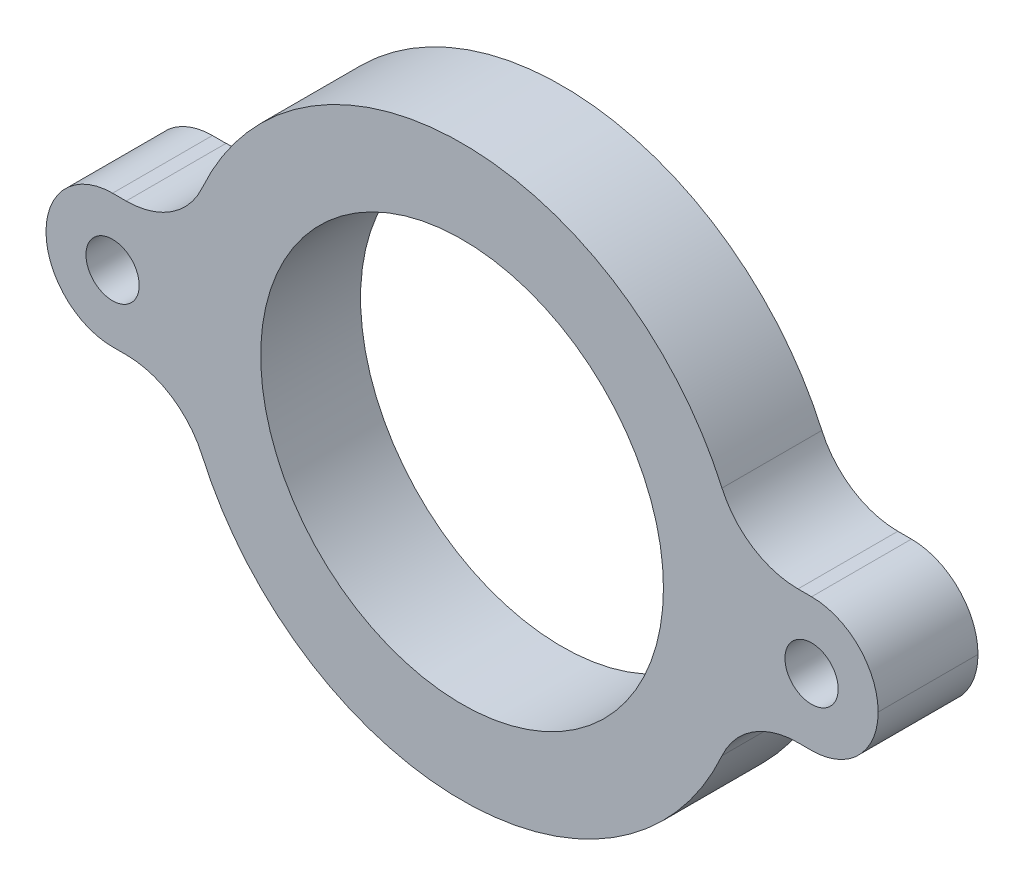
from build123d import *

# Parameters (mm, degrees)
ESBO_O1_R                = 12.1
ESBO_O1_R_2              = 1.6
RESSALTO_EXTRUS_O1_DEPTH = 6
FILETE2_R                = 5
FILETE3_R                = 4


with BuildPart() as part:
    # Esboço1 → Ressalto-extrusão1 (new body)
    with BuildSketch(Plane.XY):
        with BuildLine():
            Line((-25, 4), (-16.625582697, 4))
            ThreePointArc((-16.625582697, 4), (0, 17.1), (16.625582697, 4))
            Line((16.625582697, 4), (25, 4))
            Line((25, 4), (25, -4))
            Line((25, -4), (16.625582697, -4))
            ThreePointArc((16.625582697, -4), (0, -17.1), (-16.625582697, -4))
            Line((-16.625582697, -4), (-25, -4))
            Line((-25, -4), (-25, 4))
        make_face()
        Circle(ESBO_O1_R, mode=Mode.SUBTRACT)
        with Locations((-21, 0)):
            Circle(ESBO_O1_R_2, mode=Mode.SUBTRACT)
        with Locations((21, 0)):
            Circle(ESBO_O1_R_2, mode=Mode.SUBTRACT)
    extrude(amount=RESSALTO_EXTRUS_O1_DEPTH)

    # Filete2
    filete2_edges = [part.edges().sort_by_distance(p)[0] for p in [
        (-16.625582697, 4, 3),
        (16.625582697, 4, 3),
        (16.625582697, -4, 3),
        (-16.625582697, -4, 3),
    ]]
    fillet(filete2_edges, radius=FILETE2_R)

    # Filete3
    filete3_edges = [part.edges().sort_by_distance(p)[0] for p in [
        (25, -4, 3),
        (25, 4, 3),
        (-25, -4, 3),
        (-25, 4, 3),
    ]]
    fillet(filete3_edges, radius=FILETE3_R - 0.0001)  # a hair under: the kernel refuses the full size


solid = part.part
